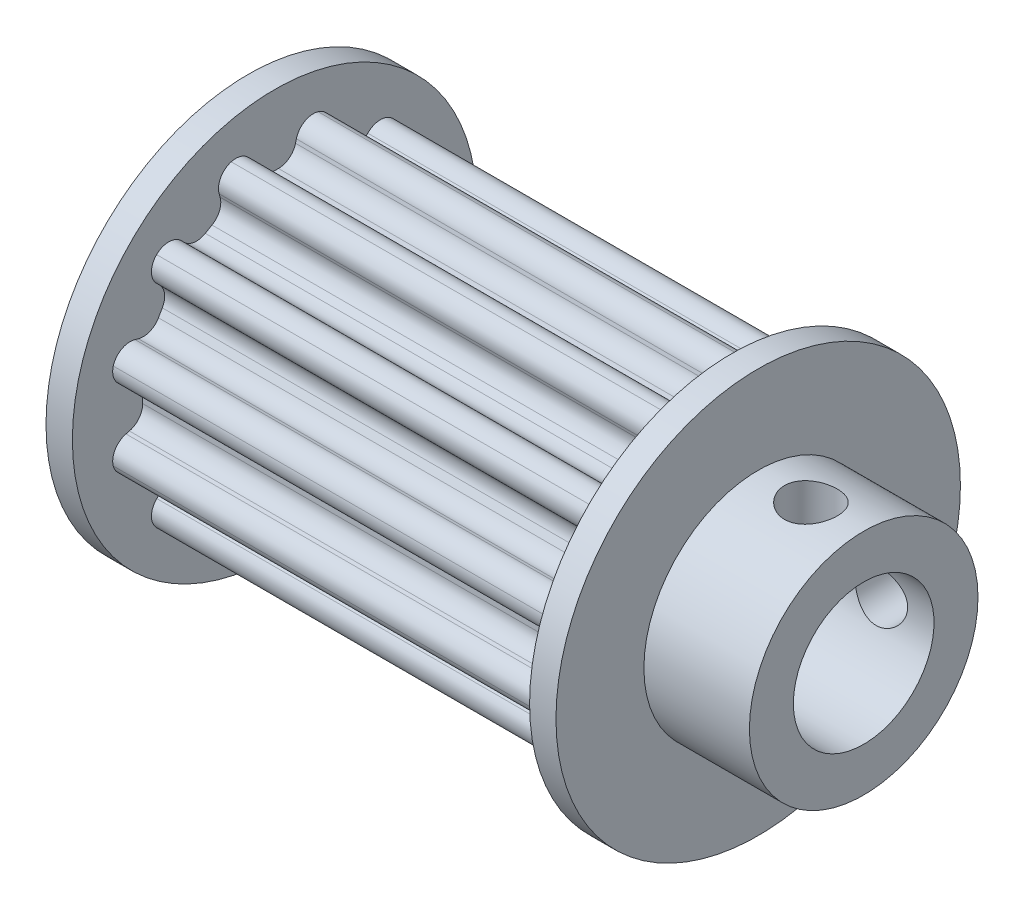
from build123d import *

# Parameters (mm, degrees)
SKETCH2_R          = 4
CUT_EXTRUDE1_DEPTH = 39.594040991
SKETCH3_R          = 1.5
CUT_EXTRUDE2_DEPTH = 39.594040991
CIRPATTERN1_COUNT  = 2
CIRPATTERN1_ANGLE  = 90
CUT_EXTRUDE3_DEPTH = 26
FILLET2_R          = 1
CIRPATTERN2_START  = 1.5
CIRPATTERN2_DEPTH  = 26


# Read off the part's stored shape, not the designer's step: CirPattern2
with BuildPart() as part:
    # Sketch1 → Revolve1 (revolve)
    with BuildSketch(Plane.XY, mode=Mode.PRIVATE) as revolve1_sk:
        Polygon((0, 0), (0, 11.5), (1.5, 11.5), (1.5, 9.5), (27.5, 9.5), (27.5, 11.5), (29, 11.5), (29, 6.5), (35, 6.5), (35, 0), align=None)
    revolve(revolve1_sk.sketch.rotate(Axis((-4.735156117, 0, 0), (1, 0, 0)), 90), axis=Axis((-4.735156117, 0, 0), (1, 0, 0)))

    # Sketch2 → Cut-Extrude1 (cut, through all)
    with BuildSketch(Plane.ZY):
        Circle(SKETCH2_R)
    extrude(amount=-CUT_EXTRUDE1_DEPTH, mode=Mode.SUBTRACT)

    # Sketch3 → Cut-Extrude2 (cut, through all)
    with BuildSketch(Plane(origin=(0, 0, 0), x_dir=(1, 0, 0), z_dir=(0, 1, 0))):
        with Locations(Location((32, 0, 0), (0, 0, 90))):
            Circle(SKETCH3_R)
    cut_extrude2 = extrude(amount=CUT_EXTRUDE2_DEPTH, mode=Mode.SUBTRACT)

    # CirPattern1: Cut-Extrude2 ×2 about axis
    cirpattern1_axis = Axis((-4.735156117, 0, 0), (-1, 0, 0))
    for i in range(1, CIRPATTERN1_COUNT):
        add(cut_extrude2.rotate(cirpattern1_axis, i * CIRPATTERN1_ANGLE / (CIRPATTERN1_COUNT - 1)), mode=Mode.SUBTRACT)

    # Sketch4 → Cut-Extrude3 (cut)
    with BuildSketch(Plane(origin=(1.5, 0, 0), x_dir=(0, 0, -1), z_dir=(1, 0, 0))):
        Polygon((2, 11.5), (-2, 11.5), (-1, 7.5), (1, 7.5), align=None)
    extrude(amount=CUT_EXTRUDE3_DEPTH, mode=Mode.SUBTRACT)

    # Fillet2
    fillet2_edges = [part.edges().sort_by_distance(p)[0] for p in [
        (14.5, 7.5, -1),
        (14.5, 9.385369037, -1.471342259),
        (14.5, 9.385369037, 1.471342259),
        (14.5, 7.5, 1),
    ]]
    fillet(fillet2_edges, radius=FILLET2_R)

    # CirPattern2 outline → CirPattern2 (cut)
    with BuildSketch(Plane.YZ.offset(CIRPATTERN2_START)):
        with BuildLine():
            ThreePointArc((9.173931529, 2.467585925), (8.227241336, 4.75), (6.723957861, 6.711064794))
            ThreePointArc((6.723957861, 6.711064794), (7.00459855, 5.999230542), (6.6998571, 5.297375964))
            Line((6.6998571, 5.297375964), (6.556490873, 5.158753439))
            ThreePointArc((6.556490873, 5.158753439), (6.261292098, 4.578713089), (6.385578732, 3.939853201))
            Line((6.385578732, 3.939853201), (6.604802325, 3.560146799))
            ThreePointArc((6.604802325, 3.560146799), (7.095927901, 3.133081473), (7.745856966, 3.098710936))
            Line((7.745856966, 3.098710936), (7.937590709, 3.153558469))
            ThreePointArc((7.937590709, 3.153558469), (8.697785327, 3.066545017), (9.173931529, 2.467585925))
        make_face()
        with BuildLine():
            ThreePointArc((6.723957861, 6.711064794), (4.757893172, 8.22267916), (2.467585925, 9.173931529))
            ThreePointArc((2.467585925, 9.173931529), (3.066545017, 8.697785327), (3.153558469, 7.937590709))
            Line((3.153558469, 7.937590709), (3.098710936, 7.745856966))
            ThreePointArc((3.098710936, 7.745856966), (3.133081473, 7.095927901), (3.560146799, 6.604802325))
            Line((3.560146799, 6.604802325), (3.939853201, 6.385578732))
            ThreePointArc((3.939853201, 6.385578732), (4.578713089, 6.261292098), (5.158753439, 6.556490873))
            Line((5.158753439, 6.556490873), (5.297272586, 6.699750184))
            ThreePointArc((5.297272586, 6.699750184), (6.008242375, 7.004605475), (6.723957861, 6.711064794))
        make_face()
        with BuildLine():
            ThreePointArc((2.467585925, 9.173931529), (0.009116775, 9.499995625), (-2.449973668, 9.178650719))
            ThreePointArc((-2.449973668, 9.178650719), (-1.693186777, 9.065775559), (-1.237733608, 8.450934433))
            Line((-1.237733608, 8.450934433), (-1.189366094, 8.257464375))
            ThreePointArc((-1.189366094, 8.257464375), (-0.834635803, 7.711794562), (-0.219223594, 7.5))
            Line((-0.219223594, 7.5), (0.219223594, 7.5))
            ThreePointArc((0.219223594, 7.5), (0.834635803, 7.711794562), (1.189366094, 8.257464375))
            Line((1.189366094, 8.257464375), (1.237697538, 8.450790151))
            ThreePointArc((1.237697538, 8.450790151), (1.700987791, 9.070287472), (2.467585925, 9.173931529))
        make_face()
        with BuildLine():
            ThreePointArc((-2.449973668, 9.178650719), (-4.742102454, 8.231795935), (-6.711064795, 6.723957862))
            ThreePointArc((-6.711064795, 6.723957862), (-5.999230542, 7.00459855), (-5.297375964, 6.6998571))
            Line((-5.297375964, 6.6998571), (-5.158753439, 6.556490873))
            ThreePointArc((-5.158753439, 6.556490873), (-4.578713089, 6.261292098), (-3.939853201, 6.385578732))
            Line((-3.939853201, 6.385578732), (-3.560146799, 6.604802325))
            ThreePointArc((-3.560146799, 6.604802325), (-3.133081473, 7.095927901), (-3.098710936, 7.745856966))
            Line((-3.098710936, 7.745856966), (-3.153517566, 7.937447722))
            ThreePointArc((-3.153517566, 7.937447722), (-3.062045097, 8.705593266), (-2.449973668, 9.178650719))
        make_face()
        with BuildLine():
            ThreePointArc((-6.711064795, 6.723957862), (-8.22267916, 4.757893172), (-9.173931529, 2.467585925))
            ThreePointArc((-9.173931529, 2.467585925), (-8.697785327, 3.066545017), (-7.937590709, 3.153558469))
            Line((-7.937590709, 3.153558469), (-7.745856966, 3.098710936))
            ThreePointArc((-7.745856966, 3.098710936), (-7.095927901, 3.133081473), (-6.604802325, 3.560146799))
            Line((-6.604802325, 3.560146799), (-6.385578732, 3.939853201))
            ThreePointArc((-6.385578732, 3.939853201), (-6.261292098, 4.578713089), (-6.556490873, 5.158753439))
            Line((-6.556490873, 5.158753439), (-6.699750184, 5.297272586))
            ThreePointArc((-6.699750184, 5.297272586), (-7.004605475, 6.008242375), (-6.711064795, 6.723957862))
        make_face()
        with BuildLine():
            ThreePointArc((-9.173931529, 2.467585925), (-9.499995625, 0.009116775), (-9.178650719, -2.449973668))
            ThreePointArc((-9.178650719, -2.449973668), (-9.065775559, -1.693186777), (-8.450934433, -1.237733608))
            Line((-8.450934433, -1.237733608), (-8.257464375, -1.189366094))
            ThreePointArc((-8.257464375, -1.189366094), (-7.711794562, -0.834635803), (-7.5, -0.219223594))
            Line((-7.5, -0.219223594), (-7.5, 0.219223594))
            ThreePointArc((-7.5, 0.219223594), (-7.711794562, 0.834635803), (-8.257464375, 1.189366094))
            Line((-8.257464375, 1.189366094), (-8.450790151, 1.237697538))
            ThreePointArc((-8.450790151, 1.237697538), (-9.070287472, 1.700987791), (-9.173931529, 2.467585925))
        make_face()
        with BuildLine():
            ThreePointArc((-9.178650719, -2.449973668), (-8.231795935, -4.742102454), (-6.723957862, -6.711064795))
            ThreePointArc((-6.723957862, -6.711064795), (-7.00459855, -5.999230542), (-6.6998571, -5.297375964))
            Line((-6.6998571, -5.297375964), (-6.556490873, -5.158753439))
            ThreePointArc((-6.556490873, -5.158753439), (-6.261292098, -4.578713089), (-6.385578732, -3.939853201))
            Line((-6.385578732, -3.939853201), (-6.604802325, -3.560146799))
            ThreePointArc((-6.604802325, -3.560146799), (-7.095927901, -3.133081473), (-7.745856966, -3.098710936))
            Line((-7.745856966, -3.098710936), (-7.937447722, -3.153517566))
            ThreePointArc((-7.937447722, -3.153517566), (-8.705593266, -3.062045097), (-9.178650719, -2.449973668))
        make_face()
        with BuildLine():
            ThreePointArc((-6.723957862, -6.711064795), (-4.757893172, -8.22267916), (-2.467585925, -9.173931529))
            ThreePointArc((-2.467585925, -9.173931529), (-3.066545017, -8.697785327), (-3.153558469, -7.937590709))
            Line((-3.153558469, -7.937590709), (-3.098710936, -7.745856966))
            ThreePointArc((-3.098710936, -7.745856966), (-3.133081473, -7.095927901), (-3.560146799, -6.604802325))
            Line((-3.560146799, -6.604802325), (-3.939853201, -6.385578732))
            ThreePointArc((-3.939853201, -6.385578732), (-4.578713089, -6.261292098), (-5.158753439, -6.556490873))
            Line((-5.158753439, -6.556490873), (-5.297272586, -6.699750184))
            ThreePointArc((-5.297272586, -6.699750184), (-6.008242375, -7.004605475), (-6.723957862, -6.711064795))
        make_face()
        with BuildLine():
            ThreePointArc((-2.467585925, -9.173931529), (-0.009116775, -9.499995625), (2.449973668, -9.178650719))
            ThreePointArc((2.449973668, -9.178650719), (1.693186777, -9.065775559), (1.237733608, -8.450934433))
            Line((1.237733608, -8.450934433), (1.189366094, -8.257464375))
            ThreePointArc((1.189366094, -8.257464375), (0.834635803, -7.711794562), (0.219223594, -7.5))
            Line((0.219223594, -7.5), (-0.219223594, -7.5))
            ThreePointArc((-0.219223594, -7.5), (-0.834635803, -7.711794562), (-1.189366094, -8.257464375))
            Line((-1.189366094, -8.257464375), (-1.237697538, -8.450790151))
            ThreePointArc((-1.237697538, -8.450790151), (-1.700987791, -9.070287472), (-2.467585925, -9.173931529))
        make_face()
        with BuildLine():
            ThreePointArc((2.449973668, -9.178650719), (4.742102454, -8.231795935), (6.711064794, -6.723957861))
            ThreePointArc((6.711064794, -6.723957861), (5.999230542, -7.00459855), (5.297375964, -6.6998571))
            Line((5.297375964, -6.6998571), (5.158753439, -6.556490873))
            ThreePointArc((5.158753439, -6.556490873), (4.578713089, -6.261292098), (3.939853201, -6.385578732))
            Line((3.939853201, -6.385578732), (3.560146799, -6.604802325))
            ThreePointArc((3.560146799, -6.604802325), (3.133081473, -7.095927901), (3.098710936, -7.745856966))
            Line((3.098710936, -7.745856966), (3.153517566, -7.937447722))
            ThreePointArc((3.153517566, -7.937447722), (3.062045097, -8.705593266), (2.449973668, -9.178650719))
        make_face()
        with BuildLine():
            Line((6.556490873, -5.158753439), (6.699750184, -5.297272586))
            ThreePointArc((6.699750184, -5.297272586), (7.004605475, -6.008242375), (6.711064795, -6.723957862))
            ThreePointArc((6.711064795, -6.723957862), (8.22267916, -4.757893172), (9.173931529, -2.467585925))
            ThreePointArc((9.173931529, -2.467585925), (8.697785327, -3.066545017), (7.937590709, -3.153558469))
            Line((7.937590709, -3.153558469), (7.745856966, -3.098710936))
            ThreePointArc((7.745856966, -3.098710936), (7.095927901, -3.133081473), (6.604802325, -3.560146799))
            Line((6.604802325, -3.560146799), (6.385578732, -3.939853201))
            ThreePointArc((6.385578732, -3.939853201), (6.261292098, -4.578713089), (6.556490873, -5.158753439))
        make_face()
    extrude(amount=CIRPATTERN2_DEPTH, mode=Mode.SUBTRACT)


solid = part.part
